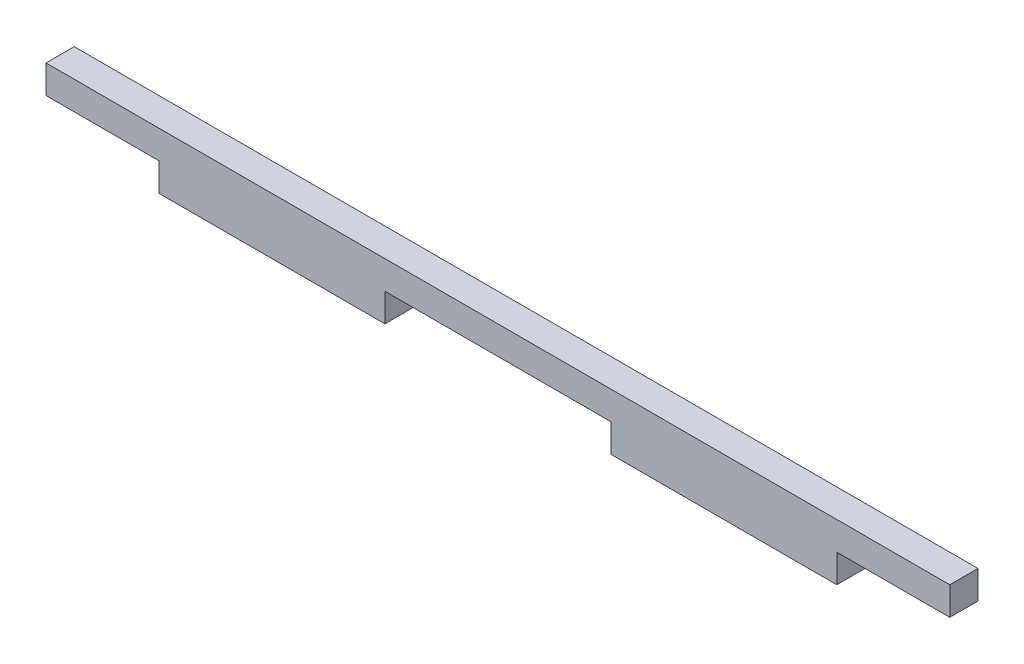
from build123d import *

# Parameters (mm, degrees)
BOSS_EXTRUDE1_DEPTH = 1.5875


with BuildPart() as part:
    # Sketch1 → Boss-Extrude1 (new, symmetric)
    with BuildSketch(Plane.XY):
        Polygon((-12.7, -1.5875), (12.7, -1.5875), (12.7, -4.7625), (38.1, -4.7625), (38.1, -1.5875), (50.8, -1.5875), (50.8, 1.5875), (-50.8, 1.5875), (-50.8, -1.5875), (-38.1, -1.5875), (-38.1, -4.7625), (-12.7, -4.7625), align=None)
    extrude(amount=BOSS_EXTRUDE1_DEPTH, both=True)


solid = part.part
